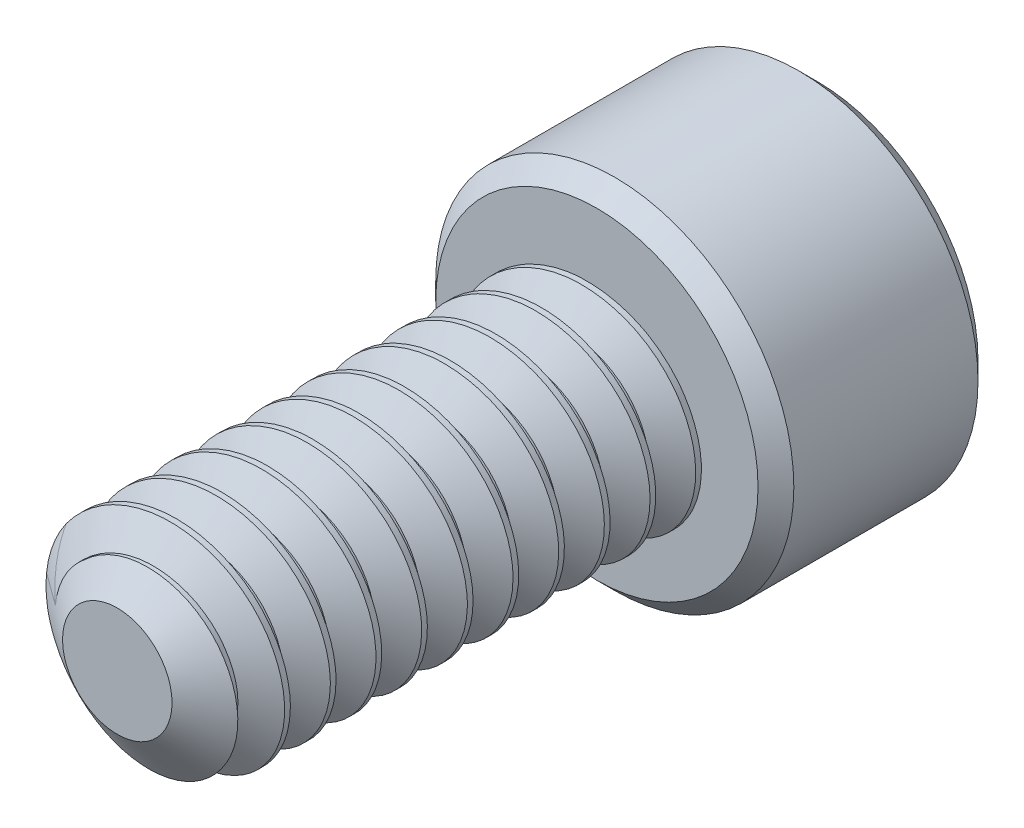
from build123d import *

# Parameters (mm, degrees)
SKETCH1_R          = 1.0922
EXTRUDE1_DEPTH     = 4.7625
CUT_SWEEP1_PITCH   = 0.453571429
SKETCH6_R          = 1.778
EXTRUDE2_DEPTH     = 2.1844
CUT_EXTRUDE1_DEPTH = 1.48828125
CHAMFER1_SIZE      = 0.1778


with BuildPart() as part:
    # Sketch1 → Extrude1 (new body)
    with BuildSketch(Plane.XY):
        Circle(SKETCH1_R)
    extrude(amount=-EXTRUDE1_DEPTH)

    # Cut-Sweep1: the profile of Sketch3 profile screwed along a right-hand helix of 11.5 turns, 6 arcs to a turn; built about Z, then put on its axis
    cut_sweep1_z = Axis((0, 0, 0), (0, 0, 1))
    cut_sweep1_corners = [(1.0925, 0, -0.397048205), (0.797596715, 0, -0.226785714), (0.797596715, 0, -0.170089286), (1.0925, 0, 0.000173205)]
    with BuildLine(mode=Mode.PRIVATE) as cut_sweep1_profile:
        Line(cut_sweep1_corners[0], cut_sweep1_corners[1])
        Line(cut_sweep1_corners[1], cut_sweep1_corners[2])
        Line(cut_sweep1_corners[2], cut_sweep1_corners[3])
        Line(cut_sweep1_corners[3], cut_sweep1_corners[0])
    cut_sweep1_cap = Face(cut_sweep1_profile.wire())
    cut_sweep1_turn_angles = [0, 30, 60, 90, 120, 150, 180, 210, 240, 270, 300, 330, 360]
    cut_sweep1_turn_weights = [1, 0.8660254037844387, 1, 0.8660254037844387, 1, 0.8660254037844387, 1, 0.8660254037844387, 1, 0.8660254037844387, 1, 0.8660254037844387, 1]
    cut_sweep1_turn_rails = [Edge.make_bspline([Vector(p[0], p[1], 0).rotate(cut_sweep1_z, cut_sweep1_turn_angles[k]) / cut_sweep1_turn_weights[k] + Vector(0, 0, p[2] + CUT_SWEEP1_PITCH * cut_sweep1_turn_angles[k] / 360) for k in range(13)], [0, 0, 0, 1, 1, 2, 2, 3, 3, 4, 4, 5, 5, 6, 6, 6], 2, cut_sweep1_turn_weights) for p in cut_sweep1_corners]
    cut_sweep1_turn_sides = [Face.make_surface_from_curves(cut_sweep1_turn_rails[p[0]], cut_sweep1_turn_rails[p[1]]) for p in [(0, 1), (1, 2), (2, 3), (3, 0)]]
    cut_sweep1_last_angles = [3960, 3990, 4020, 4050, 4080, 4110, 4140]
    cut_sweep1_last_weights = [1, 0.8660254037844387, 1, 0.8660254037844387, 1, 0.8660254037844228, 1]
    cut_sweep1_last_rails = [Edge.make_bspline([Vector(p[0], p[1], 0).rotate(cut_sweep1_z, cut_sweep1_last_angles[k]) / cut_sweep1_last_weights[k] + Vector(0, 0, p[2] + CUT_SWEEP1_PITCH * cut_sweep1_last_angles[k] / 360) for k in range(7)], [0, 0, 0, 1, 1, 2, 2, 3, 3, 3], 2, cut_sweep1_last_weights) for p in cut_sweep1_corners]
    cut_sweep1_last_sides = [Face.make_surface_from_curves(cut_sweep1_last_rails[p[0]], cut_sweep1_last_rails[p[1]]) for p in [(0, 1), (1, 2), (2, 3), (3, 0)]]
    cut_sweep1 = Plane(origin=(0, 0, 0), x_dir=(0, 1, 0), z_dir=(0, 0, -1)) * Solid(Shell([*[p.moved(Location((0, 0, CUT_SWEEP1_PITCH * i))) for i in range(11) for p in cut_sweep1_turn_sides], *cut_sweep1_last_sides, cut_sweep1_cap, cut_sweep1_cap.rotate(cut_sweep1_z, 4140).moved(Location((0, 0, CUT_SWEEP1_PITCH * 4140 / 360)))]))
    add(cut_sweep1, mode=Mode.SUBTRACT)

    # Sketch4 → Cut-Revolve1 (revolve, cut)
    with BuildSketch(Plane(origin=(0, 0, 0), x_dir=(0, 0, -1), z_dir=(1, 0, 0)), mode=Mode.PRIVATE) as cut_revolve1_sk:
        Polygon((0.384136155, 1.0922), (0, 0.543596715), (0, 1.0922), align=None)
    revolve(cut_revolve1_sk.sketch.rotate(Axis((0, 0, 0), (0, 0, -1)), 275.894515937), axis=Axis((0, 0, 0), (0, 0, -1)), mode=Mode.SUBTRACT)

    # Sketch6 → Extrude2 (add)
    with BuildSketch(Plane(origin=(0, 0, -4.7625), x_dir=(-1, 0, 0), z_dir=(0, 0, -1))):
        Circle(SKETCH6_R)
    extrude(amount=EXTRUDE2_DEPTH)

    # Sketch7 → Cut-Extrude1 (cut)
    with BuildSketch(Plane(origin=(0, 0, -6.9469), x_dir=(-1, 0, 0), z_dir=(0, 0, -1))):
        Polygon((0, 1.14567944), (-0.9921875, 0.57283972), (-0.9921875, -0.57283972), (0, -1.14567944), (0.9921875, -0.57283972), (0.9921875, 0.57283972), align=None)
    extrude(amount=-CUT_EXTRUDE1_DEPTH, mode=Mode.SUBTRACT)

    # Cut-Extrude2 cone 1 section (through the dimple's axis) → Cut-Extrude2 (revolve, cut)
    with BuildSketch(Plane(origin=(0, 0, -6.9469), x_dir=(0, 1, 0), z_dir=(1, 0, 0))):
        Polygon((0, 0), (1.14567944, 0), (0, 1.14567944), align=None)
    revolve(axis=Axis((0, 0, -6.9469), (0, 0, 1)), mode=Mode.SUBTRACT)

    # Chamfer1
    chamfer1_edges = [part.edges().sort_by_distance(p)[0] for p in [
        (1.778, 0, -4.7625),
        (1.778, 0, -6.9469),
    ]]
    chamfer(chamfer1_edges, length=CHAMFER1_SIZE)


solid = part.part
